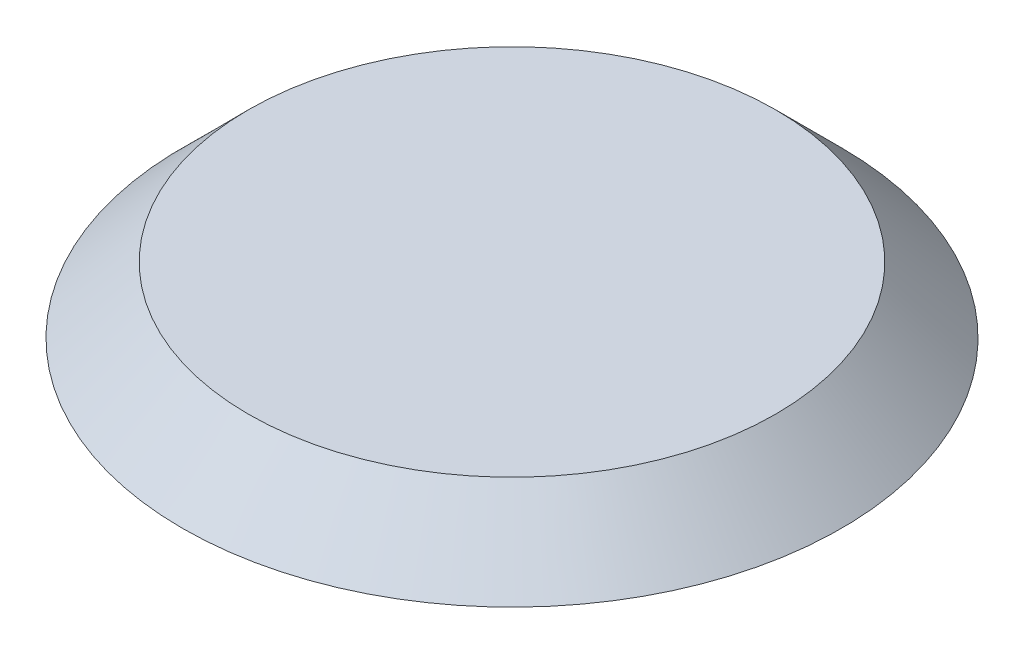
from build123d import *

# Parameters (mm, degrees)
ESQUISSE1_R        = 15
BOSS_EXTRU_1_DEPTH = 3
CHANFREIN1_SIZE    = 3


with BuildPart() as part:
    # Esquisse1 → Boss.-Extru.1 (new body)
    with BuildSketch(Plane(origin=(0, 0, 0), x_dir=(1, 0, 0), z_dir=(0, 1, 0))):
        with Locations(Location((0, 0, 0), (0, 0, 270))):
            Circle(ESQUISSE1_R)
    extrude(amount=BOSS_EXTRU_1_DEPTH)

    # Chanfrein1
    chanfrein1_edges = [part.edges().sort_by_distance(p)[0] for p in [
        (0, 3, -15),
    ]]
    chamfer(chanfrein1_edges, length=CHANFREIN1_SIZE - 0.0001)  # a hair under: the kernel refuses the full size


solid = part.part
